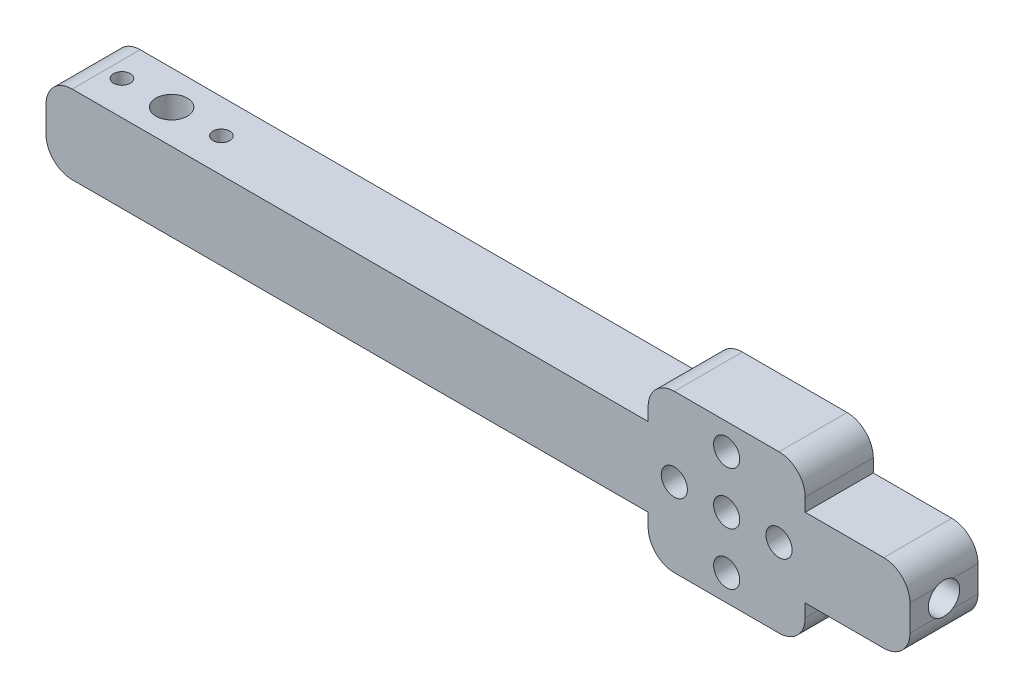
from build123d import *

# Parameters (mm, degrees)
SKETCH1_W           = 13
SKETCH1_H           = 15
BOSS_EXTRUDE1_DEPTH = 150
SKETCH5_R           = 2.5
CUT_EXTRUDE3_DEPTH  = 151.748963512
SKETCH8_W           = 13
SKETCH8_H           = 15
BOSS_EXTRUDE3_DEPTH = 15
SKETCH10_R          = 1.6
CUT_EXTRUDE4_DEPTH  = 151.888203648
SKETCH11_W          = 30
SKETCH11_H          = 30
BOSS_EXTRUDE4_DEPTH = 13
SKETCH12_R          = 2.5
CUT_EXTRUDE5_DEPTH  = 152.307633647
FILLET1_R           = 5
FILLET2_R           = 5
SKETCH13_R          = 3
CUT_EXTRUDE6_DEPTH  = 152.81732444
SKETCH14_R          = 3
CUT_EXTRUDE7_DEPTH  = 150


with BuildPart() as part:
    # Sketch1 → Boss-Extrude1 (new body)
    with BuildSketch(Plane(origin=(0, 0, 0), x_dir=(0, 0, -1), z_dir=(1, 0, 0))):
        Rectangle(SKETCH1_W, SKETCH1_H)
    extrude(amount=BOSS_EXTRUDE1_DEPTH)

    # Sketch5 → Cut-Extrude3 (cut, through all)
    with BuildSketch(Plane.XY.offset(6.5)):
        with Locations((115, 0)):
            Circle(SKETCH5_R)
        with Locations((125, 0)):
            Circle(SKETCH5_R)
        with Locations((105, 0)):
            Circle(SKETCH5_R)
    extrude(amount=-CUT_EXTRUDE3_DEPTH, mode=Mode.SUBTRACT)

    # Sketch8 → Boss-Extrude3 (add)
    with BuildSketch(Plane.ZY):
        Rectangle(SKETCH8_W, SKETCH8_H)
    extrude(amount=BOSS_EXTRUDE3_DEPTH)

    # Sketch10 → Cut-Extrude4 (cut, through all)
    with BuildSketch(Plane(origin=(0, -7.5, 0), x_dir=(-1, 0, 0), z_dir=(0, -1, 0))):
        with Locations((7, 0)):
            Circle(SKETCH10_R)
        with Locations((-12, 0)):
            Circle(SKETCH10_R)
    extrude(amount=-CUT_EXTRUDE4_DEPTH, mode=Mode.SUBTRACT)

    # Sketch11 → Boss-Extrude4 (add)
    with BuildSketch(Plane(origin=(0, 0, -6.5), x_dir=(-1, 0, 0), z_dir=(0, 0, -1))):
        with Locations((-115, 0)):
            Rectangle(SKETCH11_W, SKETCH11_H)
    extrude(amount=-BOSS_EXTRUDE4_DEPTH)

    # Sketch12 → Cut-Extrude5 (cut, through all)
    with BuildSketch(Plane(origin=(0, 0, -6.5), x_dir=(-1, 0, 0), z_dir=(0, 0, -1))):
        with Locations((-115, 10)):
            Circle(SKETCH12_R)
        with Locations((-105, 0)):
            Circle(SKETCH12_R)
        with Locations((-125, 0)):
            Circle(SKETCH12_R)
        with Locations((-115, 0)):
            Circle(SKETCH12_R)
        with Locations((-115, -10)):
            Circle(SKETCH12_R)
    extrude(amount=-CUT_EXTRUDE5_DEPTH, mode=Mode.SUBTRACT)

    # Fillet1
    fillet1_edges = [part.edges().sort_by_distance(p)[0] for p in [
        (130, -15, 0),
        (100, -15, 0),
        (100, 15, 0),
        (130, 15, 0),
    ]]
    fillet(fillet1_edges, radius=FILLET1_R)

    # Fillet2
    fillet2_edges = [part.edges().sort_by_distance(p)[0] for p in [
        (-15, -7.5, 0),
        (-15, 7.5, 0),
        (150, -7.5, 0),
        (150, 7.5, 0),
    ]]
    fillet(fillet2_edges, radius=FILLET2_R)

    # Sketch13 → Cut-Extrude6 (cut, through all)
    with BuildSketch(Plane(origin=(0, 7.5, 0), x_dir=(1, 0, 0), z_dir=(0, 1, 0))):
        with Locations((2.5, 0)):
            Circle(SKETCH13_R)
    extrude(amount=-CUT_EXTRUDE6_DEPTH, mode=Mode.SUBTRACT)

    # Sketch14 → Cut-Extrude7 (cut)
    with BuildSketch(Plane(origin=(150, 0, 0), x_dir=(0, 0, -1), z_dir=(1, 0, 0))):
        Circle(SKETCH14_R)
    extrude(amount=-CUT_EXTRUDE7_DEPTH, mode=Mode.SUBTRACT)


solid = part.part
